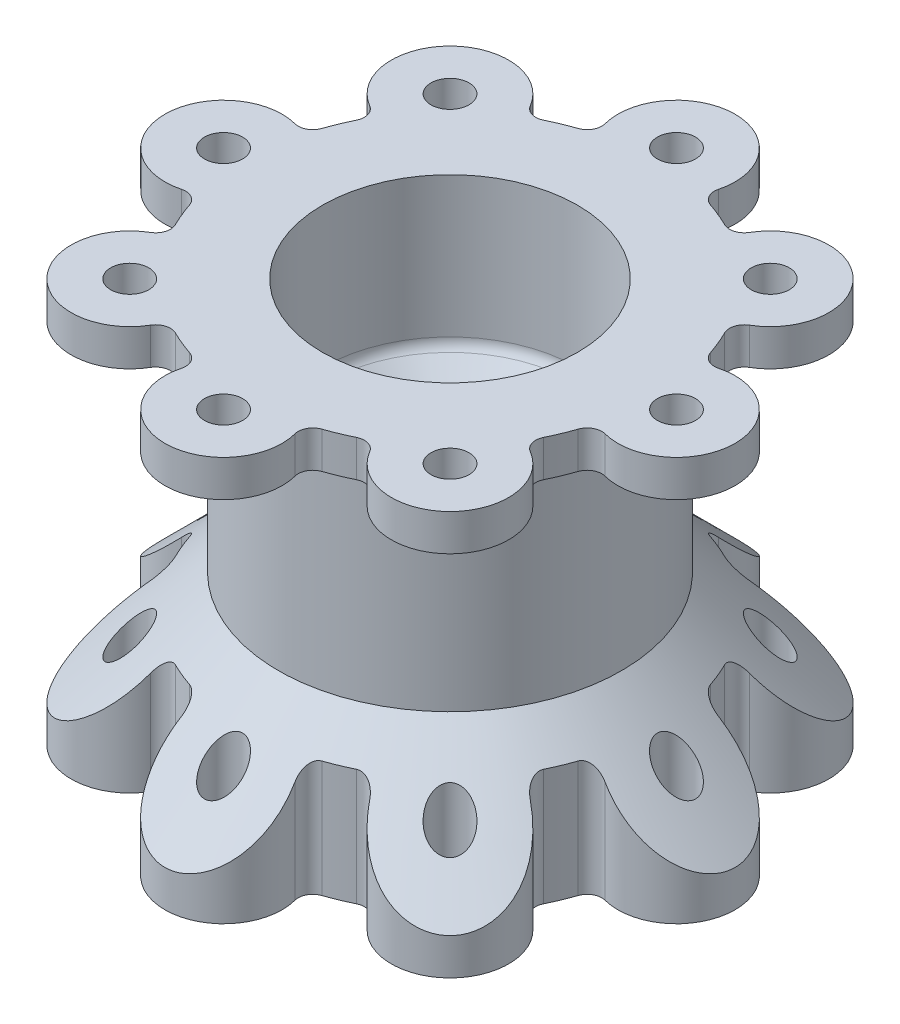
from build123d import *

# Parameters (mm, degrees)
M6_CLEARANCE_HOLE1_AT_2_COUNT = 2
M6_CLEARANCE_HOLE1_AT_2_PITCH = 39.244999996
M6_CLEARANCE_HOLE1_AT_3_COUNT = 2
M6_CLEARANCE_HOLE1_AT_3_PITCH = 39.244999996
M6_CLEARANCE_HOLE1_AT_4_COUNT = 2
M6_CLEARANCE_HOLE1_AT_4_PITCH = 39.244999996
M6_CLEARANCE_HOLE1_AT_5_COUNT = 2
M6_CLEARANCE_HOLE1_AT_5_PITCH = 39.244999996
M6_CLEARANCE_HOLE1_AT_6_COUNT = 2
M6_CLEARANCE_HOLE1_AT_6_PITCH = 39.244999996
M6_CLEARANCE_HOLE1_AT_7_COUNT = 2
M6_CLEARANCE_HOLE1_AT_7_PITCH = 39.244999996
M6_CLEARANCE_HOLE1_AT_8_COUNT = 2
M6_CLEARANCE_HOLE1_AT_8_PITCH = 39.244999996
M6_CLEARANCE_HOLE1_AT_9_COUNT = 2
M6_CLEARANCE_HOLE1_AT_9_PITCH = 39.244999996
SCALLOP_DEPTH                 = 137.16
FILLET1_R                     = 2.54


with BuildPart() as part:
    # Sketch1 → Chamber (revolve)
    with BuildSketch(Plane(origin=(0, 0, 0), x_dir=(0, 0, -1), z_dir=(1, 0, 0))):
        Polygon((22.099999996, 69.999999954), (53.849999996, 69.999999954), (53.849999996, 63.649999954), (29.719999996, 63.649999954), (29.719999996, 39.519999954), (29.719999996, 30.48), (29.719999996, 26.035), (49.404999996, 6.35), (53.849999996, 6.35), (53.849999996, 0), (22.099999996, 0), (22.099999996, 6.35), (22.099999996, 63.649999954), align=None)
    revolve(axis=Axis((0, 0, 0), (0, 1, 0)))

    # Sketch15 → M6 Clearance Hole1 (revolve, cut)
    with BuildSketch(Plane(origin=(0, 69.999999954, 0), x_dir=(0, 0, 1), z_dir=(1, 0, 0))):
        Polygon((0, 0), (0, 69.999999954), (3.325, 69.999999954), (3.3, 69.974999954), (3.3, 0), align=None)
    m6_clearance_hole1 = revolve(axis=Axis((0, 76.349999954, 0), (0, -1, 0)), mode=Mode.SUBTRACT)

    # M6 Clearance Hole1 at 2: M6 Clearance Hole1 ×2
    with Locations(*[(-i * M6_CLEARANCE_HOLE1_AT_2_PITCH, 0, 0) for i in range(1, M6_CLEARANCE_HOLE1_AT_2_COUNT)]):
        add(m6_clearance_hole1, mode=Mode.SUBTRACT)

    # M6 Clearance Hole1 at 3: M6 Clearance Hole1 ×2
    with Locations(*[Vector(-0.7071067811865501, 0, -0.707106781186545) * (i * M6_CLEARANCE_HOLE1_AT_3_PITCH) for i in range(1, M6_CLEARANCE_HOLE1_AT_3_COUNT)]):
        add(m6_clearance_hole1, mode=Mode.SUBTRACT)

    # M6 Clearance Hole1 at 4: M6 Clearance Hole1 ×2
    with Locations(*[(0, 0, -i * M6_CLEARANCE_HOLE1_AT_4_PITCH) for i in range(1, M6_CLEARANCE_HOLE1_AT_4_COUNT)]):
        add(m6_clearance_hole1, mode=Mode.SUBTRACT)

    # M6 Clearance Hole1 at 5: M6 Clearance Hole1 ×2
    with Locations(*[Vector(0.7071067811865319, 0, -0.7071067811865632) * (i * M6_CLEARANCE_HOLE1_AT_5_PITCH) for i in range(1, M6_CLEARANCE_HOLE1_AT_5_COUNT)]):
        add(m6_clearance_hole1, mode=Mode.SUBTRACT)

    # M6 Clearance Hole1 at 6: M6 Clearance Hole1 ×2
    with Locations(*[(i * M6_CLEARANCE_HOLE1_AT_6_PITCH, 0, 0) for i in range(1, M6_CLEARANCE_HOLE1_AT_6_COUNT)]):
        add(m6_clearance_hole1, mode=Mode.SUBTRACT)

    # M6 Clearance Hole1 at 7: M6 Clearance Hole1 ×2
    with Locations(*[Vector(0.7071067811865632, 0, 0.7071067811865318) * (i * M6_CLEARANCE_HOLE1_AT_7_PITCH) for i in range(1, M6_CLEARANCE_HOLE1_AT_7_COUNT)]):
        add(m6_clearance_hole1, mode=Mode.SUBTRACT)

    # M6 Clearance Hole1 at 8: M6 Clearance Hole1 ×2
    with Locations(*[(0, 0, i * M6_CLEARANCE_HOLE1_AT_8_PITCH) for i in range(1, M6_CLEARANCE_HOLE1_AT_8_COUNT)]):
        add(m6_clearance_hole1, mode=Mode.SUBTRACT)

    # M6 Clearance Hole1 at 9: M6 Clearance Hole1 ×2
    with Locations(*[Vector(-0.7071067811865449, 0, 0.7071067811865501) * (i * M6_CLEARANCE_HOLE1_AT_9_PITCH) for i in range(1, M6_CLEARANCE_HOLE1_AT_9_COUNT)]):
        add(m6_clearance_hole1, mode=Mode.SUBTRACT)


with BuildPart() as body_2:
    # Sketch17 → Scallop (new body)
    with BuildSketch(Plane(origin=(0, 69.999999954, 0), x_dir=(1, 0, 0), z_dir=(0, 1, 0))):
        with BuildLine():
            ThreePointArc((9.835679848, 36.698433303), (0, 49.404999996), (-9.835679848, 36.698433303))
            ThreePointArc((-9.835679848, 36.698433303), (-10.058801099, 34.856468384), (-11.474959823, 33.657672187))
            ThreePointArc((-11.474959823, 33.657672187), (-13.608222855, 32.853156176), (-15.685546338, 31.913590147))
            ThreePointArc((-15.685546338, 31.913590147), (-17.534598695, 31.759891631), (-18.994835129, 32.904586965))
            ThreePointArc((-18.994835129, 32.904586965), (-34.934610522, 34.934610522), (-32.904586965, 18.994835129))
            ThreePointArc((-32.904586965, 18.994835129), (-31.759891631, 17.534598695), (-31.913590147, 15.685546338))
            ThreePointArc((-31.913590147, 15.685546338), (-32.853156176, 13.608222855), (-33.657672187, 11.474959823))
            ThreePointArc((-33.657672187, 11.474959823), (-34.856468384, 10.058801099), (-36.698433303, 9.835679848))
            ThreePointArc((-36.698433303, 9.835679848), (-49.404999996, 0), (-36.698433303, -9.835679848))
            ThreePointArc((-36.698433303, -9.835679848), (-34.856468384, -10.058801099), (-33.657672187, -11.474959823))
            ThreePointArc((-33.657672187, -11.474959823), (-32.853156176, -13.608222855), (-31.913590147, -15.685546338))
            ThreePointArc((-31.913590147, -15.685546338), (-31.759891631, -17.534598695), (-32.904586965, -18.994835129))
            ThreePointArc((-32.904586965, -18.994835129), (-34.934610522, -34.934610522), (-18.994835129, -32.904586965))
            ThreePointArc((-18.994835129, -32.904586965), (-17.534598695, -31.759891631), (-15.685546338, -31.913590147))
            ThreePointArc((-15.685546338, -31.913590147), (-13.608222855, -32.853156176), (-11.474959823, -33.657672187))
            ThreePointArc((-11.474959823, -33.657672187), (-10.058801099, -34.856468384), (-9.835679848, -36.698433303))
            ThreePointArc((-9.835679848, -36.698433303), (0, -49.404999996), (9.835679848, -36.698433303))
            ThreePointArc((9.835679848, -36.698433303), (10.058801099, -34.856468384), (11.474959823, -33.657672187))
            ThreePointArc((11.474959823, -33.657672187), (13.608222855, -32.853156176), (15.685546338, -31.913590147))
            ThreePointArc((15.685546338, -31.913590147), (17.534598695, -31.759891631), (18.994835129, -32.904586965))
            ThreePointArc((18.994835129, -32.904586965), (34.934610522, -34.934610522), (32.904586965, -18.994835129))
            ThreePointArc((32.904586965, -18.994835129), (31.759891631, -17.534598695), (31.913590147, -15.685546338))
            ThreePointArc((31.913590147, -15.685546338), (32.853156176, -13.608222855), (33.657672187, -11.474959823))
            ThreePointArc((33.657672187, -11.474959823), (34.856468384, -10.058801099), (36.698433303, -9.835679848))
            ThreePointArc((36.698433303, -9.835679848), (49.404999996, 0), (36.698433303, 9.835679848))
            ThreePointArc((36.698433303, 9.835679848), (34.856468384, 10.058801099), (33.657672187, 11.474959823))
            ThreePointArc((33.657672187, 11.474959823), (32.853156176, 13.608222855), (31.913590147, 15.685546338))
            ThreePointArc((31.913590147, 15.685546338), (31.759891631, 17.534598695), (32.904586965, 18.994835129))
            ThreePointArc((32.904586965, 18.994835129), (34.934610522, 34.934610522), (18.994835129, 32.904586965))
            ThreePointArc((18.994835129, 32.904586965), (17.534598695, 31.759891631), (15.685546338, 31.913590147))
            ThreePointArc((15.685546338, 31.913590147), (13.608222855, 32.853156176), (11.474959823, 33.657672187))
            ThreePointArc((11.474959823, 33.657672187), (10.058801099, 34.856468384), (9.835679848, 36.698433303))
        make_face()
    extrude(amount=-SCALLOP_DEPTH)

    # Intersect2: read off the stored shape, not the designer's step
    # Intersect2: intersect part
    add(part.part, mode=Mode.INTERSECT)

    # Sketch18 → Turbulence Ring (revolve)
    with BuildSketch(Plane(origin=(0, 0, 0), x_dir=(0, 0, -1), z_dir=(1, 0, 0)), mode=Mode.PRIVATE) as turbulence_ring_sk:
        with BuildLine():
            Line((-22.099999996, 44.599999954), (-9.376974386, 31.876974344))
            ThreePointArc((-9.376974386, 31.876974344), (-9.376974386, 30.08092312), (-11.173025611, 30.08092312))
            Line((-11.173025611, 30.08092312), (-22.099999996, 41.007897506))
            Line((-22.099999996, 41.007897506), (-22.099999996, 44.599999954))
        make_face()
    revolve(turbulence_ring_sk.sketch.rotate(Axis((0, 78.763374349, 0), (0, -1, 0)), 180), axis=Axis((0, 78.763374349, 0), (0, -1, 0)))

    # Fillet1
    fillet1_edges = [body_2.edges().sort_by_distance(p)[0] for p in [
        (0, 41.007897506, 22.099999996),
        (0, 44.599999954, 22.099999996),
    ]]
    fillet(fillet1_edges, radius=FILLET1_R)


solid = body_2.part
